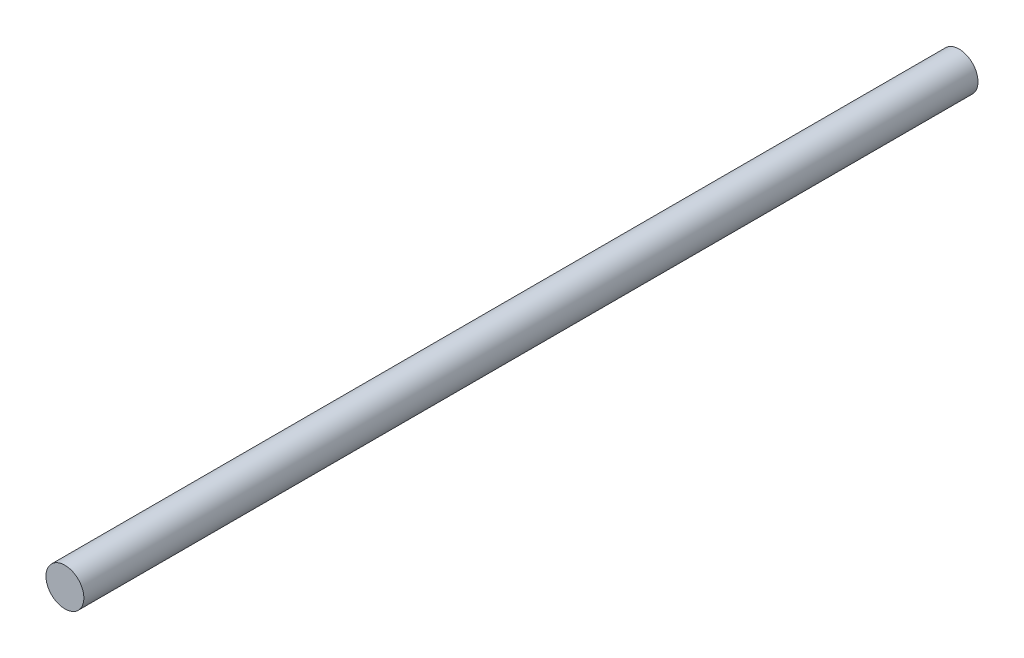
from build123d import *

# Parameters (mm, degrees)
CROQUIS1_R              = 5
SALIENTE_EXTRUIR1_DEPTH = 236


with BuildPart() as part:
    # Croquis1 → Saliente-Extruir1 (new body)
    with BuildSketch(Plane.XY):
        Circle(CROQUIS1_R)
    extrude(amount=SALIENTE_EXTRUIR1_DEPTH)


solid = part.part
